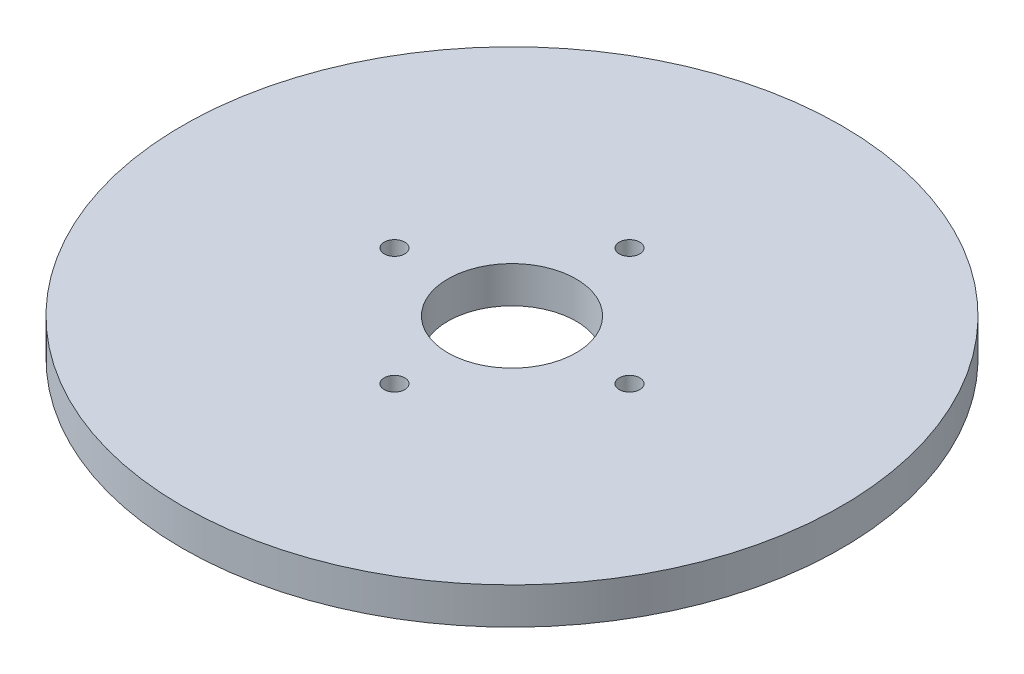
from build123d import *

# Parameters (mm, degrees)
SKETCH1_R           = 90
BOSS_EXTRUDE1_DEPTH = 10
SKETCH2_R           = 17.5
CUT_EXTRUDE1_DEPTH  = 128.671453348
SKETCH3_R           = 2.80810623
CUT_EXTRUDE2_DEPTH  = 6.050475419
CIRPATTERN1_COUNT   = 4


with BuildPart() as part:
    # Sketch1 → Boss-Extrude1 (new body)
    with BuildSketch(Plane(origin=(0, 0, 0), x_dir=(1, 0, 0), z_dir=(0, 1, 0))):
        Circle(SKETCH1_R)
    extrude(amount=BOSS_EXTRUDE1_DEPTH)

    # Sketch2 → Cut-Extrude1 (cut, through all)
    with BuildSketch(Plane(origin=(0, 0, 0), x_dir=(1, 0, 0), z_dir=(0, 1, 0))):
        Circle(SKETCH2_R)
    extrude(amount=CUT_EXTRUDE1_DEPTH, mode=Mode.SUBTRACT)

    # Sketch3 → Cut-Extrude2 (cut)
    with BuildSketch(Plane(origin=(0, 10, 0), x_dir=(1, 0, 0), z_dir=(0, 1, 0))):
        with Locations((-32.095967149, 0)):
            Circle(SKETCH3_R)
    cut_extrude2 = extrude(amount=-CUT_EXTRUDE2_DEPTH, mode=Mode.SUBTRACT)

    # CirPattern1: Cut-Extrude2 ×4 about axis
    cirpattern1_axis = Axis((0, 0, 0), (0, 1, 0))
    for i in range(1, CIRPATTERN1_COUNT):
        add(cut_extrude2.rotate(cirpattern1_axis, i * 360 / CIRPATTERN1_COUNT), mode=Mode.SUBTRACT)


solid = part.part
